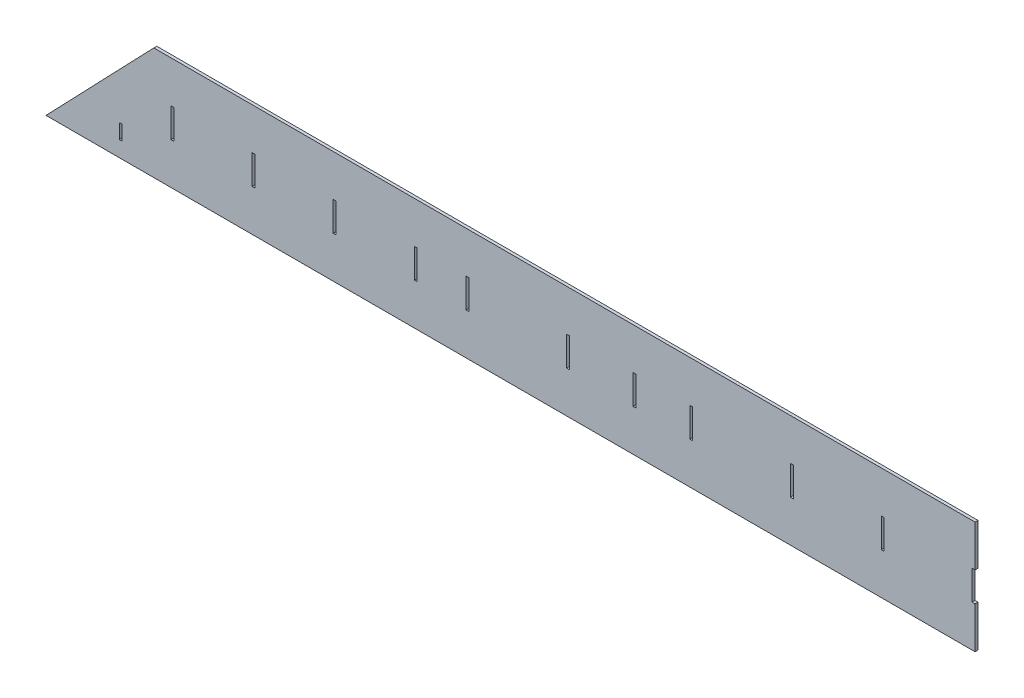
from build123d import *

# Parameters (mm, degrees)
SKETCH1_W           = 3
SKETCH1_H           = 30
SKETCH1_H_2         = 15
BOSS_EXTRUDE1_DEPTH = 3


with BuildPart() as part:
    # Sketch1 → Boss-Extrude1 (new body)
    with BuildSketch(Plane.XY):
        Polygon((0, 0), (110.35106383, 115), (951, 115), (951, 72.5), (948, 72.5), (948, 42.5), (951, 42.5), (951, 0), align=None)
        with Locations((129.5, 57.5)):
            Rectangle(SKETCH1_W, SKETCH1_H, mode=Mode.SUBTRACT)
        with Locations((76.5, 23.609115303)):
            Rectangle(SKETCH1_W, SKETCH1_H_2, mode=Mode.SUBTRACT)
        with Locations((212.5, 57.5)):
            Rectangle(SKETCH1_W, SKETCH1_H, mode=Mode.SUBTRACT)
        with Locations((295.5, 57.5)):
            Rectangle(SKETCH1_W, SKETCH1_H, mode=Mode.SUBTRACT)
        with Locations((378.5, 57.5)):
            Rectangle(SKETCH1_W, SKETCH1_H, mode=Mode.SUBTRACT)
        with Locations((431.5, 57.5)):
            Rectangle(SKETCH1_W, SKETCH1_H, mode=Mode.SUBTRACT)
        with Locations((534.5, 57.5)):
            Rectangle(SKETCH1_W, SKETCH1_H, mode=Mode.SUBTRACT)
        with Locations((602.5, 57.5)):
            Rectangle(SKETCH1_W, SKETCH1_H, mode=Mode.SUBTRACT)
        with Locations((660.5, 57.5)):
            Rectangle(SKETCH1_W, SKETCH1_H, mode=Mode.SUBTRACT)
        with Locations((763.5, 57.5)):
            Rectangle(SKETCH1_W, SKETCH1_H, mode=Mode.SUBTRACT)
        with Locations((856.5, 57.5)):
            Rectangle(SKETCH1_W, SKETCH1_H, mode=Mode.SUBTRACT)
    extrude(amount=BOSS_EXTRUDE1_DEPTH)


solid = part.part
